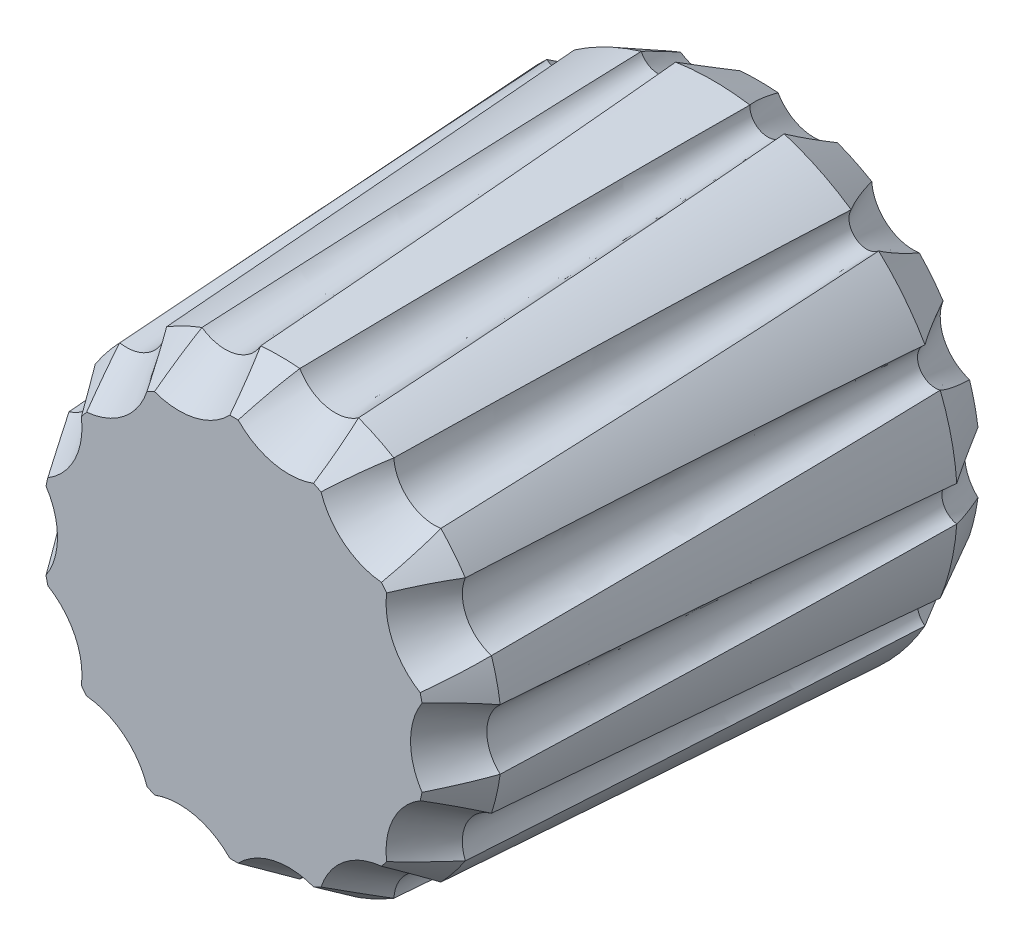
from build123d import *
from OCP.BRepFilletAPI import BRepFilletAPI_MakeChamfer

# Parameters (mm, degrees)
BOSS_EXTRU_1_DEPTH      = 17
BOSS_EXTRU_1_DRAFT      = 3
CHANFREIN1_SIZE         = 1.5
CHANFREIN1_SIZE2        = 0.841744678
CHANFREIN2_SIZE         = 0.89427247
CHANFREIN2_SIZE_2       = 1.5
ENL_V_MAT_EXTRU_1_DEPTH = 9
ENL_V_MAT_EXTRU_2_DEPTH = 2


with BuildPart() as part:
    # Boss.-Extru.1: read off the stored shape, not the designer's step
    # Boss.-Extru.1 outline → Boss.-Extru.1 (with draft: the straight prism first)
    with BuildSketch(Plane.XY.offset(17)):
        with BuildLine():
            ThreePointArc((-7.037759487, 1.00438325), (-6.609067752, 0), (-7.037759487, -1.00438325))
            ThreePointArc((-7.037759487, -1.00438325), (-6.930828581, -1.581916396), (-6.776587757, -2.148651362))
            ThreePointArc((-6.776587757, -2.148651362), (-5.954564291, -2.867567028), (-5.905016637, -3.958487441))
            ThreePointArc((-5.905016637, -3.958487441), (-5.55809298, -4.432431244), (-5.173229713, -4.876119219))
            ThreePointArc((-5.173229713, -4.876119219), (-4.120686343, -5.167177238), (-3.602712823, -6.128564646))
            ThreePointArc((-3.602712823, -6.128564646), (-3.084508898, -6.405048725), (-2.545250079, -6.637811864))
            ThreePointArc((-2.545250079, -6.637811864), (-1.470655929, -6.443364625), (-0.586847549, -7.084804462))
            ThreePointArc((-0.586847549, -7.084804462), (0, -7.109067752), (0.586847549, -7.084804462))
            ThreePointArc((0.586847549, -7.084804462), (1.470655929, -6.443364625), (2.545250079, -6.637811864))
            ThreePointArc((2.545250079, -6.637811864), (3.084508898, -6.405048725), (3.602712823, -6.128564646))
            ThreePointArc((3.602712823, -6.128564646), (4.120686343, -5.167177238), (5.173229713, -4.876119219))
            ThreePointArc((5.173229713, -4.876119219), (5.55809298, -4.432431244), (5.905016637, -3.958487441))
            ThreePointArc((5.905016637, -3.958487441), (5.954564291, -2.867567028), (6.776587757, -2.148651362))
            ThreePointArc((6.776587757, -2.148651362), (6.930828581, -1.581916396), (7.037759487, -1.00438325))
            ThreePointArc((7.037759487, -1.00438325), (6.609067752, 0), (7.037759487, 1.00438325))
            ThreePointArc((7.037759487, 1.00438325), (6.930828581, 1.581916396), (6.776587757, 2.148651362))
            ThreePointArc((6.776587757, 2.148651362), (5.954564291, 2.867567028), (5.905016637, 3.958487441))
            ThreePointArc((5.905016637, 3.958487441), (5.55809298, 4.432431244), (5.173229713, 4.876119219))
            ThreePointArc((5.173229713, 4.876119219), (4.120686343, 5.167177238), (3.602712823, 6.128564646))
            ThreePointArc((3.602712823, 6.128564646), (3.084508898, 6.405048725), (2.545250079, 6.637811864))
            ThreePointArc((2.545250079, 6.637811864), (1.470655929, 6.443364625), (0.586847549, 7.084804462))
            ThreePointArc((0.586847549, 7.084804462), (0, 7.109067752), (-0.586847549, 7.084804462))
            ThreePointArc((-0.586847549, 7.084804462), (-1.470655929, 6.443364625), (-2.545250079, 6.637811864))
            ThreePointArc((-2.545250079, 6.637811864), (-3.084508898, 6.405048725), (-3.602712823, 6.128564646))
            ThreePointArc((-3.602712823, 6.128564646), (-4.120686343, 5.167177238), (-5.173229713, 4.876119219))
            ThreePointArc((-5.173229713, 4.876119219), (-5.55809298, 4.432431244), (-5.905016637, 3.958487441))
            ThreePointArc((-5.905016637, 3.958487441), (-5.954564291, 2.867567028), (-6.776587757, 2.148651362))
            ThreePointArc((-6.776587757, 2.148651362), (-6.930828581, 1.581916396), (-7.037759487, 1.00438325))
        make_face()
    extrude(amount=-BOSS_EXTRU_1_DEPTH)
    # Boss.-Extru.1: the draft: its side faces are tilted about the plane it starts from
    boss_extru_1_sides = [part.faces().sort_by_distance(p)[0] for p in [
        (-4.120686343, 5.167177238, 8.5),
        (-5.55809298, 4.432431244, 8.5),
        (-5.954564291, 2.867567029, 8.5),
        (-6.930828581, 1.581916396, 8.5),
        (-6.609067752, 0, 8.5),
        (-6.930828581, -1.581916396, 8.5),
        (-5.954564291, -2.867567029, 8.5),
        (-5.55809298, -4.432431244, 8.5),
        (-4.120686343, -5.167177238, 8.5),
        (-3.084508898, -6.405048725, 8.5),
        (-1.470655929, -6.443364625, 8.5),
        (0, -7.109067752, 8.5),
        (1.470655929, -6.443364625, 8.5),
        (3.084508898, -6.405048725, 8.5),
        (4.120686343, -5.167177238, 8.5),
        (5.55809298, -4.432431244, 8.5),
        (5.954564291, -2.867567029, 8.5),
        (6.930828581, -1.581916396, 8.5),
        (6.609067752, 0, 8.5),
        (6.930828581, 1.581916396, 8.5),
        (5.954564291, 2.867567029, 8.5),
        (5.55809298, 4.432431244, 8.5),
        (4.120686343, 5.167177238, 8.5),
        (3.084508898, 6.405048725, 8.5),
        (1.470655929, 6.443364625, 8.5),
        (0, 7.109067752, 8.5),
        (-1.470655929, 6.443364625, 8.5),
        (-3.084508898, 6.405048725, 8.5),
    ]]
    draft(boss_extru_1_sides, Plane.XY.offset(17), BOSS_EXTRU_1_DRAFT)

    # Chanfrein1: one chamfer whose edges measure the first distance from different faces: ONE call of the kernel's chamfer builder (chamfer() names one face for all edges)
    chanfrein1_edges_1 = [part.edges().sort_by_distance(p)[0] for p in [
        (-7.799423297, 1.780167471, 0),
    ]]
    chanfrein1_side_1 = [part.faces().sort_by_distance(p)[0] for p in [
        (-7.365125939, 1.681041933, 8.5),
    ]]
    chanfrein1_edges_2 = [part.edges().sort_by_distance(p)[0] for p in [
        (-6.75726651, 3.254128043, 0),
    ]]
    chanfrein1_side_2 = [part.faces().sort_by_distance(p)[0] for p in [
        (-6.3559154, 3.060847535, 8.5),
    ]]
    chanfrein1_edges_3 = [part.edges().sort_by_distance(p)[0] for p in [
        (-6.254651859, 4.987918416, 0),
    ]]
    chanfrein1_side_3 = [part.faces().sort_by_distance(p)[0] for p in [
        (-5.906372419, 4.71017483, 8.5),
    ]]
    chanfrein1_edges_4 = [part.edges().sort_by_distance(p)[0] for p in [
        (-4.676173514, 5.863736118, 0),
    ]]
    chanfrein1_side_4 = [part.faces().sort_by_distance(p)[0] for p in [
        (-4.398429928, 5.515456678, 8.5),
    ]]
    chanfrein1_edges_5 = [part.edges().sort_by_distance(p)[0] for p in [
        (-3.471069914, 7.207750943, 0),
    ]]
    chanfrein1_side_5 = [part.faces().sort_by_distance(p)[0] for p in [
        (-3.277789406, 6.806399834, 8.5),
    ]]
    chanfrein1_edges_6 = [part.edges().sort_by_distance(p)[0] for p in [
        (-1.668907003, 7.311959342, 0),
    ]]
    chanfrein1_side_6 = [part.faces().sort_by_distance(p)[0] for p in [
        (-1.569781464, 6.877661984, 8.5),
    ]]
    chanfrein1_edges_7 = [part.edges().sort_by_distance(p)[0] for p in [
        (0, 8, 0),
    ]]
    chanfrein1_side_7 = [part.faces().sort_by_distance(p)[0] for p in [
        (0, 7.554533876, 8.5),
    ]]
    chanfrein1_edges_8 = [part.edges().sort_by_distance(p)[0] for p in [
        (1.668907003, 7.311959342, 0),
    ]]
    chanfrein1_side_8 = [part.faces().sort_by_distance(p)[0] for p in [
        (1.569781464, 6.877661984, 8.5),
    ]]
    chanfrein1_edges_9 = [part.edges().sort_by_distance(p)[0] for p in [
        (3.471069914, 7.207750943, 0),
    ]]
    chanfrein1_side_9 = [part.faces().sort_by_distance(p)[0] for p in [
        (3.277789406, 6.806399834, 8.5),
    ]]
    chanfrein1_edges_10 = [part.edges().sort_by_distance(p)[0] for p in [
        (4.676173514, 5.863736118, 0),
    ]]
    chanfrein1_side_10 = [part.faces().sort_by_distance(p)[0] for p in [
        (4.398429928, 5.515456678, 8.5),
    ]]
    chanfrein1_edges_11 = [part.edges().sort_by_distance(p)[0] for p in [
        (6.254651859, 4.987918416, 0),
    ]]
    chanfrein1_side_11 = [part.faces().sort_by_distance(p)[0] for p in [
        (5.906372419, 4.71017483, 8.5),
    ]]
    chanfrein1_edges_12 = [part.edges().sort_by_distance(p)[0] for p in [
        (6.75726651, 3.254128043, 0),
    ]]
    chanfrein1_side_12 = [part.faces().sort_by_distance(p)[0] for p in [
        (6.3559154, 3.060847535, 8.5),
    ]]
    chanfrein1_edges_13 = [part.edges().sort_by_distance(p)[0] for p in [
        (7.799423297, 1.780167471, 0),
    ]]
    chanfrein1_side_13 = [part.faces().sort_by_distance(p)[0] for p in [
        (7.365125939, 1.681041933, 8.5),
    ]]
    chanfrein1_edges_14 = [part.edges().sort_by_distance(p)[0] for p in [
        (7.5, 0, 0),
    ]]
    chanfrein1_side_14 = [part.faces().sort_by_distance(p)[0] for p in [
        (7.054533876, 0, 8.5),
    ]]
    chanfrein1_edges_15 = [part.edges().sort_by_distance(p)[0] for p in [
        (7.799423297, -1.780167471, 0),
    ]]
    chanfrein1_side_15 = [part.faces().sort_by_distance(p)[0] for p in [
        (7.365125939, -1.681041933, 8.5),
    ]]
    chanfrein1_edges_16 = [part.edges().sort_by_distance(p)[0] for p in [
        (6.75726651, -3.254128043, 0),
    ]]
    chanfrein1_side_16 = [part.faces().sort_by_distance(p)[0] for p in [
        (6.3559154, -3.060847535, 8.5),
    ]]
    chanfrein1_edges_17 = [part.edges().sort_by_distance(p)[0] for p in [
        (6.254651859, -4.987918416, 0),
    ]]
    chanfrein1_side_17 = [part.faces().sort_by_distance(p)[0] for p in [
        (5.906372419, -4.71017483, 8.5),
    ]]
    chanfrein1_edges_18 = [part.edges().sort_by_distance(p)[0] for p in [
        (4.676173514, -5.863736118, 0),
    ]]
    chanfrein1_side_18 = [part.faces().sort_by_distance(p)[0] for p in [
        (4.398429928, -5.515456678, 8.5),
    ]]
    chanfrein1_edges_19 = [part.edges().sort_by_distance(p)[0] for p in [
        (3.471069914, -7.207750943, 0),
    ]]
    chanfrein1_side_19 = [part.faces().sort_by_distance(p)[0] for p in [
        (3.277789406, -6.806399834, 8.5),
    ]]
    chanfrein1_edges_20 = [part.edges().sort_by_distance(p)[0] for p in [
        (1.668907003, -7.311959342, 0),
    ]]
    chanfrein1_side_20 = [part.faces().sort_by_distance(p)[0] for p in [
        (1.569781464, -6.877661984, 8.5),
    ]]
    chanfrein1_edges_21 = [part.edges().sort_by_distance(p)[0] for p in [
        (0, -8, 0),
    ]]
    chanfrein1_side_21 = [part.faces().sort_by_distance(p)[0] for p in [
        (0, -7.554533876, 8.5),
    ]]
    chanfrein1_edges_22 = [part.edges().sort_by_distance(p)[0] for p in [
        (-1.668907003, -7.311959342, 0),
    ]]
    chanfrein1_side_22 = [part.faces().sort_by_distance(p)[0] for p in [
        (-1.569781464, -6.877661984, 8.5),
    ]]
    chanfrein1_edges_23 = [part.edges().sort_by_distance(p)[0] for p in [
        (-3.471069914, -7.207750943, 0),
    ]]
    chanfrein1_side_23 = [part.faces().sort_by_distance(p)[0] for p in [
        (-3.277789406, -6.806399834, 8.5),
    ]]
    chanfrein1_edges_24 = [part.edges().sort_by_distance(p)[0] for p in [
        (-4.676173514, -5.863736118, 0),
    ]]
    chanfrein1_side_24 = [part.faces().sort_by_distance(p)[0] for p in [
        (-4.398429928, -5.515456678, 8.5),
    ]]
    chanfrein1_edges_25 = [part.edges().sort_by_distance(p)[0] for p in [
        (-6.254651859, -4.987918416, 0),
    ]]
    chanfrein1_side_25 = [part.faces().sort_by_distance(p)[0] for p in [
        (-5.906372419, -4.71017483, 8.5),
    ]]
    chanfrein1_edges_26 = [part.edges().sort_by_distance(p)[0] for p in [
        (-6.75726651, -3.254128043, 0),
    ]]
    chanfrein1_side_26 = [part.faces().sort_by_distance(p)[0] for p in [
        (-6.3559154, -3.060847535, 8.5),
    ]]
    chanfrein1_edges_27 = [part.edges().sort_by_distance(p)[0] for p in [
        (-7.799423297, -1.780167471, 0),
    ]]
    chanfrein1_side_27 = [part.faces().sort_by_distance(p)[0] for p in [
        (-7.365125939, -1.681041933, 8.5),
    ]]
    chanfrein1_edges_28 = [part.edges().sort_by_distance(p)[0] for p in [
        (-7.5, 0, 0),
    ]]
    chanfrein1_side_28 = [part.faces().sort_by_distance(p)[0] for p in [
        (-7.054533876, 0, 8.5),
    ]]
    chanfrein1 = BRepFilletAPI_MakeChamfer(part.part.solid().wrapped)
    for e in chanfrein1_edges_1:
        chanfrein1.Add(CHANFREIN1_SIZE, CHANFREIN1_SIZE2, e.wrapped, chanfrein1_side_1[0].wrapped)  # the first distance lies on this face
    for e in chanfrein1_edges_2:
        chanfrein1.Add(CHANFREIN1_SIZE, CHANFREIN1_SIZE2, e.wrapped, chanfrein1_side_2[0].wrapped)  # the first distance lies on this face
    for e in chanfrein1_edges_3:
        chanfrein1.Add(CHANFREIN1_SIZE, CHANFREIN1_SIZE2, e.wrapped, chanfrein1_side_3[0].wrapped)  # the first distance lies on this face
    for e in chanfrein1_edges_4:
        chanfrein1.Add(CHANFREIN1_SIZE, CHANFREIN1_SIZE2, e.wrapped, chanfrein1_side_4[0].wrapped)  # the first distance lies on this face
    for e in chanfrein1_edges_5:
        chanfrein1.Add(CHANFREIN1_SIZE, CHANFREIN1_SIZE2, e.wrapped, chanfrein1_side_5[0].wrapped)  # the first distance lies on this face
    for e in chanfrein1_edges_6:
        chanfrein1.Add(CHANFREIN1_SIZE, CHANFREIN1_SIZE2, e.wrapped, chanfrein1_side_6[0].wrapped)  # the first distance lies on this face
    for e in chanfrein1_edges_7:
        chanfrein1.Add(CHANFREIN1_SIZE, CHANFREIN1_SIZE2, e.wrapped, chanfrein1_side_7[0].wrapped)  # the first distance lies on this face
    for e in chanfrein1_edges_8:
        chanfrein1.Add(CHANFREIN1_SIZE, CHANFREIN1_SIZE2, e.wrapped, chanfrein1_side_8[0].wrapped)  # the first distance lies on this face
    for e in chanfrein1_edges_9:
        chanfrein1.Add(CHANFREIN1_SIZE, CHANFREIN1_SIZE2, e.wrapped, chanfrein1_side_9[0].wrapped)  # the first distance lies on this face
    for e in chanfrein1_edges_10:
        chanfrein1.Add(CHANFREIN1_SIZE, CHANFREIN1_SIZE2, e.wrapped, chanfrein1_side_10[0].wrapped)  # the first distance lies on this face
    for e in chanfrein1_edges_11:
        chanfrein1.Add(CHANFREIN1_SIZE, CHANFREIN1_SIZE2, e.wrapped, chanfrein1_side_11[0].wrapped)  # the first distance lies on this face
    for e in chanfrein1_edges_12:
        chanfrein1.Add(CHANFREIN1_SIZE, CHANFREIN1_SIZE2, e.wrapped, chanfrein1_side_12[0].wrapped)  # the first distance lies on this face
    for e in chanfrein1_edges_13:
        chanfrein1.Add(CHANFREIN1_SIZE, CHANFREIN1_SIZE2, e.wrapped, chanfrein1_side_13[0].wrapped)  # the first distance lies on this face
    for e in chanfrein1_edges_14:
        chanfrein1.Add(CHANFREIN1_SIZE, CHANFREIN1_SIZE2, e.wrapped, chanfrein1_side_14[0].wrapped)  # the first distance lies on this face
    for e in chanfrein1_edges_15:
        chanfrein1.Add(CHANFREIN1_SIZE, CHANFREIN1_SIZE2, e.wrapped, chanfrein1_side_15[0].wrapped)  # the first distance lies on this face
    for e in chanfrein1_edges_16:
        chanfrein1.Add(CHANFREIN1_SIZE, CHANFREIN1_SIZE2, e.wrapped, chanfrein1_side_16[0].wrapped)  # the first distance lies on this face
    for e in chanfrein1_edges_17:
        chanfrein1.Add(CHANFREIN1_SIZE, CHANFREIN1_SIZE2, e.wrapped, chanfrein1_side_17[0].wrapped)  # the first distance lies on this face
    for e in chanfrein1_edges_18:
        chanfrein1.Add(CHANFREIN1_SIZE, CHANFREIN1_SIZE2, e.wrapped, chanfrein1_side_18[0].wrapped)  # the first distance lies on this face
    for e in chanfrein1_edges_19:
        chanfrein1.Add(CHANFREIN1_SIZE, CHANFREIN1_SIZE2, e.wrapped, chanfrein1_side_19[0].wrapped)  # the first distance lies on this face
    for e in chanfrein1_edges_20:
        chanfrein1.Add(CHANFREIN1_SIZE, CHANFREIN1_SIZE2, e.wrapped, chanfrein1_side_20[0].wrapped)  # the first distance lies on this face
    for e in chanfrein1_edges_21:
        chanfrein1.Add(CHANFREIN1_SIZE, CHANFREIN1_SIZE2, e.wrapped, chanfrein1_side_21[0].wrapped)  # the first distance lies on this face
    for e in chanfrein1_edges_22:
        chanfrein1.Add(CHANFREIN1_SIZE, CHANFREIN1_SIZE2, e.wrapped, chanfrein1_side_22[0].wrapped)  # the first distance lies on this face
    for e in chanfrein1_edges_23:
        chanfrein1.Add(CHANFREIN1_SIZE, CHANFREIN1_SIZE2, e.wrapped, chanfrein1_side_23[0].wrapped)  # the first distance lies on this face
    for e in chanfrein1_edges_24:
        chanfrein1.Add(CHANFREIN1_SIZE, CHANFREIN1_SIZE2, e.wrapped, chanfrein1_side_24[0].wrapped)  # the first distance lies on this face
    for e in chanfrein1_edges_25:
        chanfrein1.Add(CHANFREIN1_SIZE, CHANFREIN1_SIZE2, e.wrapped, chanfrein1_side_25[0].wrapped)  # the first distance lies on this face
    for e in chanfrein1_edges_26:
        chanfrein1.Add(CHANFREIN1_SIZE, CHANFREIN1_SIZE2, e.wrapped, chanfrein1_side_26[0].wrapped)  # the first distance lies on this face
    for e in chanfrein1_edges_27:
        chanfrein1.Add(CHANFREIN1_SIZE, CHANFREIN1_SIZE2, e.wrapped, chanfrein1_side_27[0].wrapped)  # the first distance lies on this face
    for e in chanfrein1_edges_28:
        chanfrein1.Add(CHANFREIN1_SIZE, CHANFREIN1_SIZE2, e.wrapped, chanfrein1_side_28[0].wrapped)  # the first distance lies on this face
    add(Compound.cast(chanfrein1.Shape()), mode=Mode.REPLACE)

    # Chanfrein2
    # the kernel refuses this chamfer: 1.5, 0.89427247 mm, written as the material it takes off along each edge
    with BuildSketch(Plane(origin=(7.2e-08, -1.9e-08, 17), x_dir=(-0.6577900982308998, 0.7532012922648124, 0), z_dir=(0.7532012922648124, 0.6577900982308998, 0))) as chanfrein2_piece_1:
        Polygon((7.109067826 - CHANFREIN2_SIZE, 0), (7.109067826 + CHANFREIN2_SIZE_2 * 0.0523359562429, -CHANFREIN2_SIZE_2 * 0.998629534755), (7.109067826, 0), align=None)
    revolve(axis=Axis((7.2e-08, -1.9e-08, 17), (0, 0, 1)), revolution_arc=72.022614027, mode=Mode.SUBTRACT)
    with BuildSketch(Plane(origin=(-7.207750944, 3.471069914, 17), x_dir=(-0.8996013380481169, 0.43671207057057343, 0), z_dir=(-0.43671207057057343, -0.8996013380481169, 0))) as chanfrein2_piece_2:
        Polygon((1.390932248 + CHANFREIN2_SIZE, 0), (1.390932248 - CHANFREIN2_SIZE_2 * 0.0523359562429, CHANFREIN2_SIZE_2 * 0.998629534755), (1.390932248, 0), align=None)
    revolve(axis=Axis((-7.207750944, 3.471069914, 17), (0, 0, -1)), revolution_arc=359.64, mode=Mode.SUBTRACT)
    with BuildSketch(Plane(origin=(-7.4e-08, 5.7e-08, 17), x_dir=(-0.2658465931621742, 0.9640153468197824, 0), z_dir=(0.9640153468197824, 0.2658465931621742, 0))) as chanfrein2_piece_3:
        Polygon((7.109067659 - CHANFREIN2_SIZE, 0), (7.109067659 + CHANFREIN2_SIZE_2 * 0.0523359562429, -CHANFREIN2_SIZE_2 * 0.998629534755), (7.109067659, 0), align=None)
    revolve(axis=Axis((-7.4e-08, 5.7e-08, 17), (0, 0, 1)), revolution_arc=72.022615713, mode=Mode.SUBTRACT)
    with BuildSketch(Plane(origin=(-4.987918414, 6.254651858, 17), x_dir=(-0.621030533193622, 0.7837863719415167, 0), z_dir=(-0.7837863719415167, -0.621030533193622, 0))) as chanfrein2_piece_4:
        Polygon((1.390932247 - CHANFREIN2_SIZE_2 * 0.0523359562429, CHANFREIN2_SIZE_2 * 0.998629534755), (1.390932247 + CHANFREIN2_SIZE, 0), (1.390932247, 0), align=None)
    revolve(axis=Axis((-4.987918414, 6.254651858, 17), (0, 0, -1)), revolution_arc=359.64, mode=Mode.SUBTRACT)
    with BuildSketch(Plane(origin=(-5e-08, 1.04e-07, 17), x_dir=(0.1787510808463709, 0.9838943292326947, 0), z_dir=(0.9838943292326947, -0.1787510808463709, 0))) as chanfrein2_piece_5:
        Polygon((7.109067637 + CHANFREIN2_SIZE_2 * 0.0523359562429, -CHANFREIN2_SIZE_2 * 0.998629534755), (7.109067637 - CHANFREIN2_SIZE, 0), (7.109067637, 0), align=None)
    revolve(axis=Axis((-5e-08, 1.04e-07, 17), (0, 0, 1)), revolution_arc=72.022615941, mode=Mode.SUBTRACT)
    with BuildSketch(Plane(origin=(-1.780167472, 7.799423297, 17), x_dir=(-0.21945701467314238, 0.9756221700590614, 0), z_dir=(-0.9756221700590614, -0.21945701467314238, 0))) as chanfrein2_piece_6:
        Polygon((1.390932248 + CHANFREIN2_SIZE, 0), (1.390932248 - CHANFREIN2_SIZE_2 * 0.0523359562429, CHANFREIN2_SIZE_2 * 0.998629534755), (1.390932248, 0), align=None)
    revolve(axis=Axis((-1.780167472, 7.799423297, 17), (0, 0, -1)), revolution_arc=359.64, mode=Mode.SUBTRACT)
    with BuildSketch(Plane(origin=(0, -1.65e-07, 17), x_dir=(0.5879448894477423, 0.8089009871252983, 0), z_dir=(0.8089009871252983, -0.5879448894477423, 0))) as chanfrein2_piece_7:
        Polygon((7.109067917 - CHANFREIN2_SIZE, 0), (7.109067917 + CHANFREIN2_SIZE_2 * 0.0523359562429, -CHANFREIN2_SIZE_2 * 0.998629534755), (7.109067917, 0), align=None)
    revolve(axis=Axis((0, -1.65e-07, 17), (0, 0, 1)), revolution_arc=72.0226131, mode=Mode.SUBTRACT)
    with BuildSketch(Plane(origin=(1.780167472, 7.799423297, 17), x_dir=(0.22558265733003352, 0.9742240320952469, 0), z_dir=(-0.9742240320952469, 0.22558265733003352, 0))) as chanfrein2_piece_8:
        Polygon((1.390932248 + CHANFREIN2_SIZE, 0), (1.390932248 - CHANFREIN2_SIZE_2 * 0.0523359562429, CHANFREIN2_SIZE_2 * 0.998629534755), (1.390932248, 0), align=None)
    revolve(axis=Axis((1.780167472, 7.799423297, 17), (0, 0, -1)), revolution_arc=359.64, mode=Mode.SUBTRACT)
    with BuildSketch(Plane(origin=(5e-08, 1.04e-07, 17), x_dir=(0.8806890381075737, 0.47369485764271974, 0), z_dir=(0.47369485764271974, -0.8806890381075737, 0))) as chanfrein2_piece_9:
        Polygon((7.109067637 - CHANFREIN2_SIZE, 0), (7.109067637 + CHANFREIN2_SIZE_2 * 0.0523359562429, -CHANFREIN2_SIZE_2 * 0.998629534755), (7.109067637, 0), align=None)
    revolve(axis=Axis((5e-08, 1.04e-07, 17), (0, 0, 1)), revolution_arc=72.022615941, mode=Mode.SUBTRACT)
    with BuildSketch(Plane(origin=(4.987918414, 6.254651858, 17), x_dir=(0.625942917195738, 0.7798688764224981, 0), z_dir=(-0.7798688764224981, 0.625942917195738, 0))) as chanfrein2_piece_10:
        Polygon((1.390932247 + CHANFREIN2_SIZE, 0), (1.390932247 - CHANFREIN2_SIZE_2 * 0.0523359562429, CHANFREIN2_SIZE_2 * 0.998629534755), (1.390932247, 0), align=None)
    revolve(axis=Axis((4.987918414, 6.254651858, 17), (0, 0, -1)), revolution_arc=359.64, mode=Mode.SUBTRACT)
    with BuildSketch(Plane(origin=(7.4e-08, 5.7e-08, 17), x_dir=(0.9990019015707929, 0.044667669045290966, 0), z_dir=(0.044667669045290966, -0.9990019015707929, 0))) as chanfrein2_piece_11:
        Polygon((7.109067659 - CHANFREIN2_SIZE, 0), (7.109067659 + CHANFREIN2_SIZE_2 * 0.0523359562429, -CHANFREIN2_SIZE_2 * 0.998629534755), (7.109067659, 0), align=None)
    revolve(axis=Axis((7.4e-08, 5.7e-08, 17), (0, 0, 1)), revolution_arc=72.022615713, mode=Mode.SUBTRACT)
    with BuildSketch(Plane(origin=(7.207750944, 3.471069914, 17), x_dir=(0.9023275054987795, 0.4310511255296176, 0), z_dir=(-0.4310511255296176, 0.9023275054987795, 0))) as chanfrein2_piece_12:
        Polygon((1.390932248 + CHANFREIN2_SIZE, 0), (1.390932248 - CHANFREIN2_SIZE_2 * 0.0523359562429, CHANFREIN2_SIZE_2 * 0.998629534755), (1.390932248, 0), align=None)
    revolve(axis=Axis((7.207750944, 3.471069914, 17), (0, 0, -1)), revolution_arc=359.64, mode=Mode.SUBTRACT)
    with BuildSketch(Plane(origin=(-7.2e-08, -1.9e-08, 17), x_dir=(0.9194501934322231, -0.3932064874813835, 0), z_dir=(-0.3932064874813835, -0.9194501934322231, 0))) as chanfrein2_piece_13:
        Polygon((7.109067826 - CHANFREIN2_SIZE, 0), (7.109067826 + CHANFREIN2_SIZE_2 * 0.0523359562429, -CHANFREIN2_SIZE_2 * 0.998629534755), (7.109067826, 0), align=None)
    revolve(axis=Axis((-7.2e-08, -1.9e-08, 17), (0, 0, 1)), revolution_arc=72.022614027, mode=Mode.SUBTRACT)
    with BuildSketch(Plane(origin=(7.999999999, 0, 17), x_dir=(0.9999950652018582, -0.003141587485878631, 0), z_dir=(0.003141587485878631, 0.9999950652018582, 0))) as chanfrein2_piece_14:
        Polygon((1.390932247 + CHANFREIN2_SIZE, 0), (1.390932247 - CHANFREIN2_SIZE_2 * 0.0523359562429, CHANFREIN2_SIZE_2 * 0.998629534755), (1.390932247, 0), align=None)
    revolve(axis=Axis((7.999999999, 0, 17), (0, 0, -1)), revolution_arc=359.64, mode=Mode.SUBTRACT)
    with BuildSketch(Plane(origin=(-7.2e-08, 1.9e-08, 17), x_dir=(0.6577900982308998, -0.7532012922648124, 0), z_dir=(-0.7532012922648124, -0.6577900982308998, 0))) as chanfrein2_piece_15:
        Polygon((7.109067826 - CHANFREIN2_SIZE, 0), (7.109067826 + CHANFREIN2_SIZE_2 * 0.0523359562429, -CHANFREIN2_SIZE_2 * 0.998629534755), (7.109067826, 0), align=None)
    revolve(axis=Axis((-7.2e-08, 1.9e-08, 17), (0, 0, 1)), revolution_arc=72.022614027, mode=Mode.SUBTRACT)
    with BuildSketch(Plane(origin=(7.207750944, -3.471069914, 17), x_dir=(0.8996013380481169, -0.43671207057057343, 0), z_dir=(0.43671207057057343, 0.8996013380481169, 0))) as chanfrein2_piece_16:
        Polygon((1.390932248 + CHANFREIN2_SIZE, 0), (1.390932248 - CHANFREIN2_SIZE_2 * 0.0523359562429, CHANFREIN2_SIZE_2 * 0.998629534755), (1.390932248, 0), align=None)
    revolve(axis=Axis((7.207750944, -3.471069914, 17), (0, 0, -1)), revolution_arc=359.64, mode=Mode.SUBTRACT)
    with BuildSketch(Plane(origin=(7.4e-08, -5.7e-08, 17), x_dir=(0.2658465931621742, -0.9640153468197824, 0), z_dir=(-0.9640153468197824, -0.2658465931621742, 0))) as chanfrein2_piece_17:
        Polygon((7.109067659 - CHANFREIN2_SIZE, 0), (7.109067659 + CHANFREIN2_SIZE_2 * 0.0523359562429, -CHANFREIN2_SIZE_2 * 0.998629534755), (7.109067659, 0), align=None)
    revolve(axis=Axis((7.4e-08, -5.7e-08, 17), (0, 0, 1)), revolution_arc=72.022615713, mode=Mode.SUBTRACT)
    with BuildSketch(Plane(origin=(4.987918414, -6.254651858, 17), x_dir=(0.6210305331936199, -0.7837863719415183, 0), z_dir=(0.7837863719415183, 0.6210305331936199, 0))) as chanfrein2_piece_18:
        Polygon((1.390932247 + CHANFREIN2_SIZE, 0), (1.390932247 - CHANFREIN2_SIZE_2 * 0.0523359562429, CHANFREIN2_SIZE_2 * 0.998629534755), (1.390932247, 0), align=None)
    revolve(axis=Axis((4.987918414, -6.254651858, 17), (0, 0, -1)), revolution_arc=359.64, mode=Mode.SUBTRACT)
    with BuildSketch(Plane(origin=(5e-08, -1.04e-07, 17), x_dir=(-0.1787510808463711, -0.9838943292326947, 0), z_dir=(-0.9838943292326947, 0.1787510808463711, 0))) as chanfrein2_piece_19:
        Polygon((7.109067637 - CHANFREIN2_SIZE, 0), (7.109067637 + CHANFREIN2_SIZE_2 * 0.0523359562429, -CHANFREIN2_SIZE_2 * 0.998629534755), (7.109067637, 0), align=None)
    revolve(axis=Axis((5e-08, -1.04e-07, 17), (0, 0, 1)), revolution_arc=72.022615941, mode=Mode.SUBTRACT)
    with BuildSketch(Plane(origin=(1.780167472, -7.799423297, 17), x_dir=(0.21945701467314238, -0.9756221700590614, 0), z_dir=(0.9756221700590614, 0.21945701467314238, 0))) as chanfrein2_piece_20:
        Polygon((1.390932248 + CHANFREIN2_SIZE, 0), (1.390932248 - CHANFREIN2_SIZE_2 * 0.0523359562429, CHANFREIN2_SIZE_2 * 0.998629534755), (1.390932248, 0), align=None)
    revolve(axis=Axis((1.780167472, -7.799423297, 17), (0, 0, -1)), revolution_arc=359.64, mode=Mode.SUBTRACT)
    with BuildSketch(Plane(origin=(0, 1.65e-07, 17), x_dir=(-0.5879448894477423, -0.8089009871252983, 0), z_dir=(-0.8089009871252983, 0.5879448894477423, 0))) as chanfrein2_piece_21:
        Polygon((7.109067917 - CHANFREIN2_SIZE, 0), (7.109067917 + CHANFREIN2_SIZE_2 * 0.0523359562429, -CHANFREIN2_SIZE_2 * 0.998629534755), (7.109067917, 0), align=None)
    revolve(axis=Axis((0, 1.65e-07, 17), (0, 0, 1)), revolution_arc=72.0226131, mode=Mode.SUBTRACT)
    with BuildSketch(Plane(origin=(-1.780167472, -7.799423297, 17), x_dir=(-0.22558265733003352, -0.9742240320952469, 0), z_dir=(0.9742240320952469, -0.22558265733003352, 0))) as chanfrein2_piece_22:
        Polygon((1.390932248 + CHANFREIN2_SIZE, 0), (1.390932248 - CHANFREIN2_SIZE_2 * 0.0523359562429, CHANFREIN2_SIZE_2 * 0.998629534755), (1.390932248, 0), align=None)
    revolve(axis=Axis((-1.780167472, -7.799423297, 17), (0, 0, -1)), revolution_arc=359.64, mode=Mode.SUBTRACT)
    with BuildSketch(Plane(origin=(-5e-08, -1.04e-07, 17), x_dir=(-0.8806890381075737, -0.47369485764271974, 0), z_dir=(-0.47369485764271974, 0.8806890381075737, 0))) as chanfrein2_piece_23:
        Polygon((7.109067637 - CHANFREIN2_SIZE, 0), (7.109067637 + CHANFREIN2_SIZE_2 * 0.0523359562429, -CHANFREIN2_SIZE_2 * 0.998629534755), (7.109067637, 0), align=None)
    revolve(axis=Axis((-5e-08, -1.04e-07, 17), (0, 0, 1)), revolution_arc=72.022615941, mode=Mode.SUBTRACT)
    with BuildSketch(Plane(origin=(-4.987918414, -6.254651858, 17), x_dir=(-0.625942917195738, -0.7798688764224981, 0), z_dir=(0.7798688764224981, -0.625942917195738, 0))) as chanfrein2_piece_24:
        Polygon((1.390932247 + CHANFREIN2_SIZE, 0), (1.390932247 - CHANFREIN2_SIZE_2 * 0.0523359562429, CHANFREIN2_SIZE_2 * 0.998629534755), (1.390932247, 0), align=None)
    revolve(axis=Axis((-4.987918414, -6.254651858, 17), (0, 0, -1)), revolution_arc=359.64, mode=Mode.SUBTRACT)
    with BuildSketch(Plane(origin=(-7.4e-08, -5.7e-08, 17), x_dir=(-0.9990019015707929, -0.044667669045290966, 0), z_dir=(-0.044667669045290966, 0.9990019015707929, 0))) as chanfrein2_piece_25:
        Polygon((7.109067659 - CHANFREIN2_SIZE, 0), (7.109067659 + CHANFREIN2_SIZE_2 * 0.0523359562429, -CHANFREIN2_SIZE_2 * 0.998629534755), (7.109067659, 0), align=None)
    revolve(axis=Axis((-7.4e-08, -5.7e-08, 17), (0, 0, 1)), revolution_arc=72.022615713, mode=Mode.SUBTRACT)
    with BuildSketch(Plane(origin=(-7.207750944, -3.471069914, 17), x_dir=(-0.9023275054987795, -0.4310511255296176, 0), z_dir=(0.4310511255296176, -0.9023275054987795, 0))) as chanfrein2_piece_26:
        Polygon((1.390932248 + CHANFREIN2_SIZE, 0), (1.390932248 - CHANFREIN2_SIZE_2 * 0.0523359562429, CHANFREIN2_SIZE_2 * 0.998629534755), (1.390932248, 0), align=None)
    revolve(axis=Axis((-7.207750944, -3.471069914, 17), (0, 0, -1)), revolution_arc=359.64, mode=Mode.SUBTRACT)
    with BuildSketch(Plane(origin=(7.2e-08, 1.9e-08, 17), x_dir=(-0.9194501934322231, 0.3932064874813835, 0), z_dir=(0.3932064874813835, 0.9194501934322231, 0))) as chanfrein2_piece_27:
        Polygon((7.109067826 - CHANFREIN2_SIZE, 0), (7.109067826 + CHANFREIN2_SIZE_2 * 0.0523359562429, -CHANFREIN2_SIZE_2 * 0.998629534755), (7.109067826, 0), align=None)
    revolve(axis=Axis((7.2e-08, 1.9e-08, 17), (0, 0, 1)), revolution_arc=72.022614027, mode=Mode.SUBTRACT)
    with BuildSketch(Plane(origin=(-7.999999999, 0, 17), x_dir=(-0.9999950652018582, 0.003141587485878631, 0), z_dir=(-0.003141587485878631, -0.9999950652018582, 0))) as chanfrein2_piece_28:
        Polygon((1.390932247 + CHANFREIN2_SIZE, 0), (1.390932247 - CHANFREIN2_SIZE_2 * 0.0523359562429, CHANFREIN2_SIZE_2 * 0.998629534755), (1.390932247, 0), align=None)
    revolve(axis=Axis((-7.999999999, 0, 17), (0, 0, -1)), revolution_arc=359.64, mode=Mode.SUBTRACT)

    # Esquisse2 → Enlèv. mat.-Extru.1 (cut)
    with BuildSketch(Plane(origin=(0, 0, 0), x_dir=(-1, 0, 0), z_dir=(0, 0, -1))):
        with BuildLine():
            Line((-1.610124219, -1.1), (1.610124219, -1.1))
            ThreePointArc((1.610124219, -1.1), (1.863094499, -0.57565518), (1.95, 0))
            ThreePointArc((1.95, 0), (-0.57565518, 1.863094499), (-1.610124219, -1.1))
        make_face()
    extrude(amount=-ENL_V_MAT_EXTRU_1_DEPTH, mode=Mode.SUBTRACT)

    # Esquisse2<3> → Enlèv. mat.-Extru.2 (cut)
    with BuildSketch(Plane(origin=(0, 0, 0), x_dir=(-1, 0, 0), z_dir=(0, 0, -1))):
        with BuildLine():
            ThreePointArc((-1.610124219, -1.1), (0, -1.95), (1.610124219, -1.1))
            Line((1.610124219, -1.1), (-1.610124219, -1.1))
        make_face()
        with BuildLine():
            Line((-1.610124219, -1.1), (1.610124219, -1.1))
            ThreePointArc((1.610124219, -1.1), (1.863094499, -0.57565518), (1.95, 0))
            ThreePointArc((1.95, 0), (-0.57565518, 1.863094499), (-1.610124219, -1.1))
        make_face()
    extrude(amount=-ENL_V_MAT_EXTRU_2_DEPTH, mode=Mode.SUBTRACT)


solid = part.part
